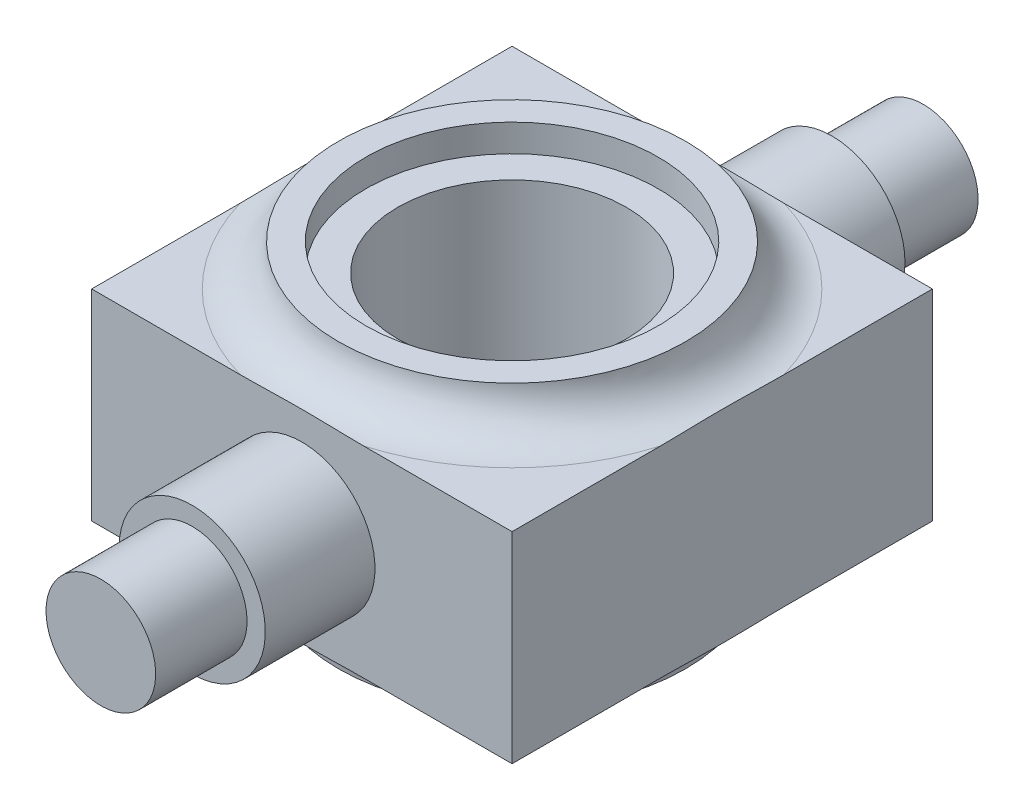
from build123d import *

# Parameters (mm, degrees)
SKETCH1_W           = 46
SKETCH1_H           = 46
BOSS_EXTRUDE1_DEPTH = 11
SKETCH2_R           = 19
BOSS_EXTRUDE2_DEPTH = 4.5
FILLET1_R           = 5
SKETCH3_R           = 16
CUT_EXTRUDE1_DEPTH  = 3
SKETCH4_R           = 12.5
CUT_EXTRUDE2_DEPTH  = 41.127920628
MIRROR1_START       = -12.5
MIRROR1_OUTLINE_R   = 16
MIRROR1_DEPTH       = 23.5
MIRROR1_START_2     = -15.5
MIRROR1_2_OUTLINE_W = 46
MIRROR1_2_OUTLINE_H = 46
MIRROR1_2_OUTLINE_R = 16
MIRROR1_2_DEPTH     = 4.5
SKETCH5_R           = 12.5
CUT_EXTRUDE3_DEPTH  = 42.955333564
SKETCH6_R           = 8
BOSS_EXTRUDE3_DEPTH = 12
SKETCH7_R           = 6
BOSS_EXTRUDE4_DEPTH = 10


with BuildPart() as part:
    # Sketch1 → Boss-Extrude1 (new, symmetric)
    with BuildSketch(Plane(origin=(0, 0, 0), x_dir=(1, 0, 0), z_dir=(0, 1, 0))):
        Rectangle(SKETCH1_W, SKETCH1_H)
    extrude(amount=BOSS_EXTRUDE1_DEPTH, both=True)

    # Sketch2 → Boss-Extrude2 (add)
    with BuildSketch(Plane(origin=(0, 11, 0), x_dir=(1, 0, 0), z_dir=(0, 1, 0))):
        with Locations(Location((0, 0, 0), (0, 0, 270))):
            Circle(SKETCH2_R)
    extrude(amount=BOSS_EXTRUDE2_DEPTH)

    # Fillet1
    # the kernel refuses this fillet: 5 mm, written as the material it adds along each edge
    with BuildSketch(Plane(origin=(0, 11, 0), x_dir=(0, 0, 1), z_dir=(-1, 0, 0))) as fillet1_piece_1_section:
        with BuildLine():
            CenterArc((23.974937186, 5), FILLET1_R, 185.739170477, 84.260829523)
            Line((19, 4.5), (19, 0))
            Line((19, 0), (23.974937186, 0))
        make_face()
    fillet1_piece_1 = revolve(axis=Axis((0, 11, 0), (0, 1, 0)), mode=Mode.PRIVATE)
    fillet1_piece_1 = split(fillet1_piece_1, bisect_by=Plane(origin=(0, 11, 23), z_dir=(0, 0, -1)), keep=Keep.TOP, mode=Mode.PRIVATE)
    fillet1_piece_1 = split(fillet1_piece_1, bisect_by=Plane(origin=(23, 11, 0), z_dir=(-1, 0, 0)), keep=Keep.TOP, mode=Mode.PRIVATE)
    fillet1_piece_1 = split(fillet1_piece_1, bisect_by=Plane(origin=(-23, 11, 0), z_dir=(1, 0, 0)), keep=Keep.TOP, mode=Mode.PRIVATE)
    fillet1_piece_1 = split(fillet1_piece_1, bisect_by=Plane(origin=(0, 11, -23), z_dir=(0, 0, 1)), keep=Keep.TOP, mode=Mode.PRIVATE)
    add(fillet1_piece_1)

    # Sketch3 → Cut-Extrude1 (cut)
    with BuildSketch(Plane(origin=(0, 15.5, 0), x_dir=(1, 0, 0), z_dir=(0, 1, 0))):
        with Locations(Location((0, 0, 0), (0, 0, 270))):
            Circle(SKETCH3_R)
    extrude(amount=-CUT_EXTRUDE1_DEPTH, mode=Mode.SUBTRACT)

    # Sketch4 → Cut-Extrude2 (cut, through all)
    with BuildSketch(Plane(origin=(0, 12.5, 0), x_dir=(1, 0, 0), z_dir=(0, 1, 0))):
        with Locations(Location((0, 0, 0), (0, 0, 270))):
            Circle(SKETCH4_R)
    extrude(amount=-CUT_EXTRUDE2_DEPTH, mode=Mode.SUBTRACT)

    # Mirror1: read off the stored shape, not the designer's step
    # Mirror1 outline → Mirror1 (add)
    with BuildSketch(Plane(origin=(0, 0, 0), x_dir=(1, 0, 0), z_dir=(0, 1, 0)).offset(MIRROR1_START)):
        Circle(MIRROR1_OUTLINE_R)
    extrude(amount=MIRROR1_DEPTH)

    # Mirror1 2 outline → Mirror1 2 (add)
    with BuildSketch(Plane(origin=(0, 0, 0), x_dir=(1, 0, 0), z_dir=(0, 1, 0)).offset(MIRROR1_START_2)):
        Rectangle(MIRROR1_2_OUTLINE_W, MIRROR1_2_OUTLINE_H)
        Circle(MIRROR1_2_OUTLINE_R, mode=Mode.SUBTRACT)
    extrude(amount=MIRROR1_2_DEPTH)

    # Mirror1 3 outline → Mirror1 3 (revolve, cut)
    with BuildSketch(Plane.XY):
        with BuildLine():
            Line((32.526911935, -11), (23.974937186, -11))
            ThreePointArc((23.974937186, -11), (20.620835219, -12.291900756), (19, -15.5))
            Line((19, -15.5), (32.526911935, -15.5))
            Line((32.526911935, -15.5), (32.526911935, -11))
        make_face()
    revolve(axis=Axis((0, 0, 0), (0, 1, 0)), mode=Mode.SUBTRACT)

    # Sketch5 → Cut-Extrude3 (cut, through all)
    with BuildSketch(Plane(origin=(0, 11, 0), x_dir=(1, 0, 0), z_dir=(0, 1, 0))):
        with Locations(Location((0, 0, 0), (0, 0, 270))):
            Circle(SKETCH5_R)
    extrude(amount=-CUT_EXTRUDE3_DEPTH, mode=Mode.SUBTRACT)

    # Sketch6 → Boss-Extrude3 (add)
    with BuildSketch(Plane(origin=(0, 0, -23), x_dir=(-1, 0, 0), z_dir=(0, 0, -1))):
        with Locations(Location((0, 0, 0), (0, 0, 180))):
            Circle(SKETCH6_R)
    boss_extrude3 = extrude(amount=BOSS_EXTRUDE3_DEPTH)

    # Sketch7 → Boss-Extrude4 (add)
    with BuildSketch(Plane(origin=(0, 0, -35), x_dir=(-1, 0, 0), z_dir=(0, 0, -1))):
        Circle(SKETCH7_R)
    boss_extrude4 = extrude(amount=BOSS_EXTRUDE4_DEPTH)

    # Mirror2: Boss-Extrude3, Boss-Extrude4 across plane
    add(boss_extrude3.mirror(Plane.XY))
    add(boss_extrude4.mirror(Plane.XY))


solid = part.part
